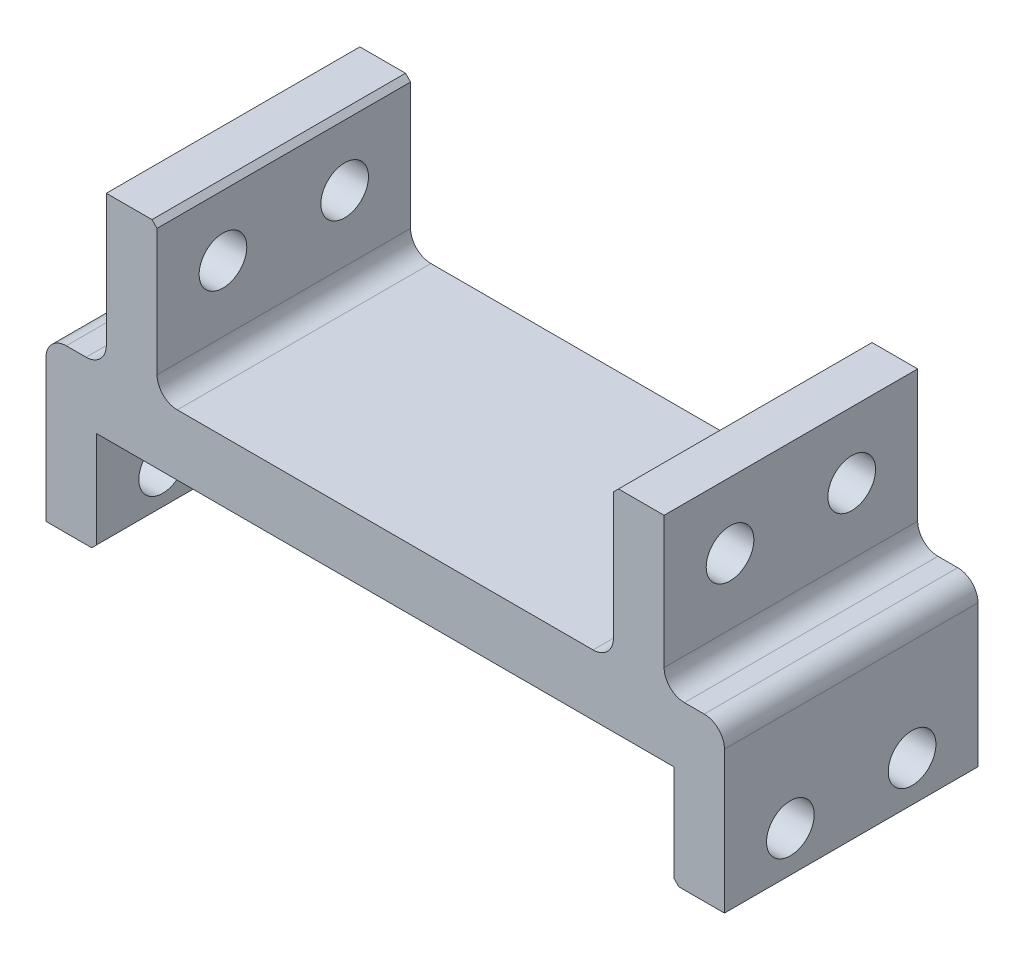
from build123d import *

# Parameters (mm, degrees)
BOSS_EXTRUDE3_DEPTH     = 12.5
CUT_EXTRUDE1_DEPTH      = 42.528213301
CUT_EXTRUDE1_DEPTH_BACK = 42.528213301
SKETCH6_R               = 2.35
CHAMFER1_SIZE           = 0.5


with BuildPart() as part:
    # Sketch5 → Boss-Extrude3 (new, symmetric)
    with BuildSketch(Plane.XY):
        with BuildLine():
            Line((-28.45, -9.8), (-28.45, 0.2))
            Line((-28.45, 0.2), (28.45, 0.2))
            Line((28.45, 0.2), (28.45, -9.8))
            Line((28.45, -9.8), (33.45, -9.8))
            Line((33.45, -9.8), (33.45, 4.2))
            ThreePointArc((33.45, 4.2), (32.864213562, 5.614213562), (31.45, 6.2))
            Line((31.45, 6.2), (29.5, 6.2))
            ThreePointArc((29.5, 6.2), (28.085786438, 6.785786438), (27.5, 8.2))
            Line((27.5, 8.2), (27.5, 21.2))
            Line((27.5, 21.2), (22.5, 21.2))
            Line((22.5, 21.2), (22.5, 8.2))
            ThreePointArc((22.5, 8.2), (21.914213562, 6.785786438), (20.5, 6.2))
            Line((20.5, 6.2), (-20.5, 6.2))
            ThreePointArc((-20.5, 6.2), (-21.914213562, 6.785786438), (-22.5, 8.2))
            Line((-22.5, 8.2), (-22.5, 21.2))
            Line((-22.5, 21.2), (-27.5, 21.2))
            Line((-27.5, 21.2), (-27.5, 8.2))
            ThreePointArc((-27.5, 8.2), (-28.085786438, 6.785786438), (-29.5, 6.2))
            Line((-29.5, 6.2), (-31.45, 6.2))
            ThreePointArc((-31.45, 6.2), (-32.864213562, 5.614213562), (-33.45, 4.2))
            Line((-33.45, 4.2), (-33.45, -9.8))
            Line((-33.45, -9.8), (-28.45, -9.8))
        make_face()
    extrude(amount=BOSS_EXTRUDE3_DEPTH, both=True)

    # Sketch6 → Cut-Extrude1 (cut, two sides: drawn at the far end of the back side and taken through both)
    with BuildSketch(Plane(origin=(0, 0, 0), x_dir=(0, 0, -1), z_dir=(1, 0, 0)).offset(-CUT_EXTRUDE1_DEPTH_BACK)):
        with Locations((-6, 14.7)):
            Circle(SKETCH6_R)
        with Locations((6, 14.7)):
            Circle(SKETCH6_R)
        with Locations((6, -5.8)):
            Circle(SKETCH6_R)
        with Locations((-6, -5.8)):
            Circle(SKETCH6_R)
    extrude(amount=CUT_EXTRUDE1_DEPTH + CUT_EXTRUDE1_DEPTH_BACK, mode=Mode.SUBTRACT)

    # Chamfer1
    chamfer1_edges = [part.edges().sort_by_distance(p)[0] for p in [
        (22.5, 21.2, 0),
        (-22.5, 21.2, 0),
        (28.45, -9.8, 0),
        (-28.45, -9.8, 0),
    ]]
    chamfer(chamfer1_edges, length=CHAMFER1_SIZE)


solid = part.part
